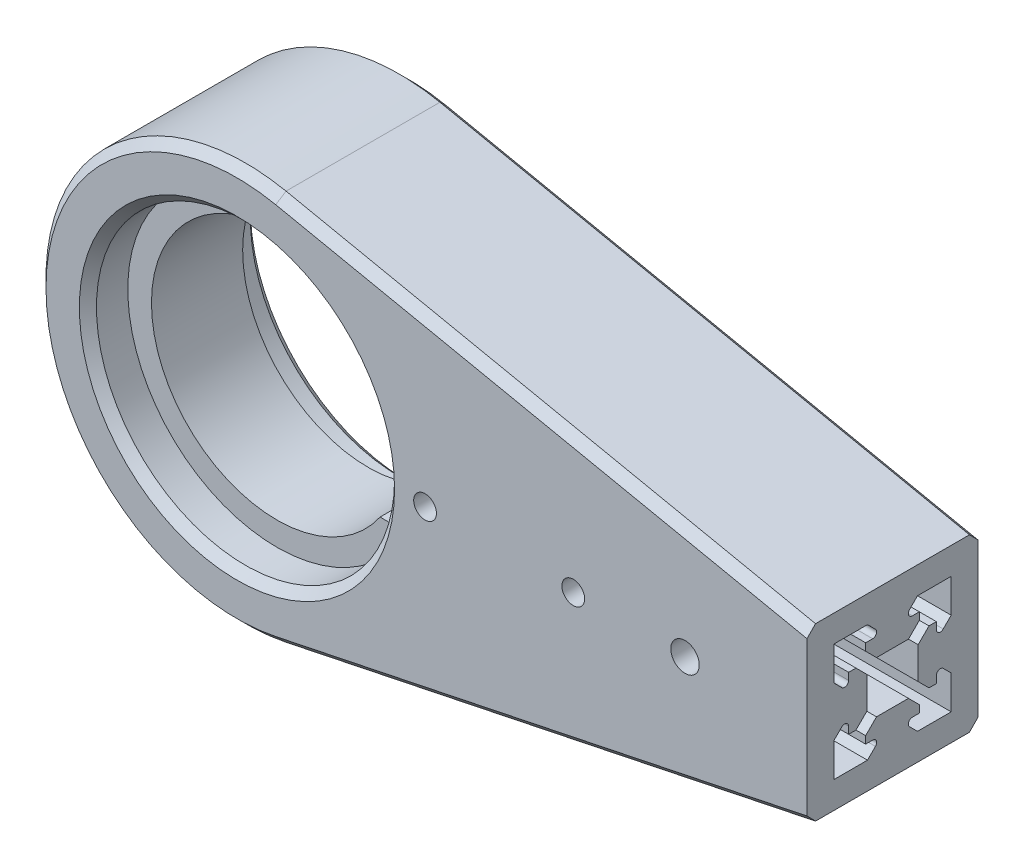
from build123d import *

# Parameters (mm, degrees)
SKETCH1_R           = 26.15
SKETCH1_R_2         = 2
SKETCH1_R_3         = 2.5
BOSS_EXTRUDE1_DEPTH = 30
BOSS_EXTRUDE2_START = -23
BOSS_EXTRUDE2_DEPTH = 16
CHAMFER1_SIZE       = 1.5
CUT_EXTRUDE1_DEPTH  = 90


with BuildPart() as part:
    # Sketch1 → Boss-Extrude1 (new body)
    with BuildSketch(Plane.XY):
        with BuildLine():
            Line((100, 15), (100, -15))
            Line((100, -15), (7.109450059, -34.270332941))
            ThreePointArc((7.109450059, -34.270332941), (-35, 0), (7.109450059, 34.270332941))
            Line((7.109450059, 34.270332941), (100, 15))
        make_face()
        Circle(SKETCH1_R, mode=Mode.SUBTRACT)
        with Locations((59, 0)):
            Circle(SKETCH1_R_2, mode=Mode.SUBTRACT)
        with Locations((78.6, 0)):
            Circle(SKETCH1_R_3, mode=Mode.SUBTRACT)
        with Locations((33, 0)):
            Circle(SKETCH1_R_2, mode=Mode.SUBTRACT)
    extrude(amount=BOSS_EXTRUDE1_DEPTH)

    # Sketch2 → Boss-Extrude2 (add)
    with BuildSketch(Plane.XY.offset(30).offset(BOSS_EXTRUDE2_START)):
        with BuildLine():
            Line((18.10386699, 12.5), (22.968946428, 12.5))
            ThreePointArc((22.968946428, 12.5), (-26.15, 0), (22.968946428, -12.5))
            Line((22.968946428, -12.5), (18.10386699, -12.5))
            ThreePointArc((18.10386699, -12.5), (-22, 0), (18.10386699, 12.5))
        make_face()
    extrude(amount=BOSS_EXTRUDE2_DEPTH)

    # Chamfer1
    chamfer1_edges = [part.edges().sort_by_distance(p)[0] for p in [
        (-26.15, 0, 30),
        (-26.15, 0, 0),
        (53.554725029, 24.63516647, 30),
        (-35, 0, 30),
        (53.554725029, -24.63516647, 30),
        (53.554725029, 24.63516647, 0),
        (-35, 0, 0),
        (53.554725029, -24.63516647, 0),
    ]]
    chamfer(chamfer1_edges, length=CHAMFER1_SIZE)

    # Sketch3 → Cut-Extrude1 (cut)
    with BuildSketch(Plane(origin=(100, 0, 0), x_dir=(0, 0, -1), z_dir=(1, 0, 0))):
        with BuildLine():
            Line((-12.197056275, 4.5), (-17.802943725, 4.5))
            Line((-17.802943725, 4.5), (-19.710050506, 6.407106781))
            Line((-19.710050506, 6.407106781), (-19.710050506, 7.7))
            Line((-19.710050506, 7.7), (-18.482842712, 7.7))
            ThreePointArc((-18.482842712, 7.7), (-17.83612704, 8.132121597), (-17.987867966, 8.894974747))
            Line((-17.987867966, 8.894974747), (-19.387867966, 10.294974747))
            Line((-19.387867966, 10.294974747), (-25.294974747, 10.294974747))
            Line((-25.294974747, 10.294974747), (-25.294974747, 4.387867966))
            Line((-25.294974747, 4.387867966), (-23.894974747, 2.987867966))
            ThreePointArc((-23.894974747, 2.987867966), (-23.132121597, 2.83612704), (-22.7, 3.482842712))
            Line((-22.7, 3.482842712), (-22.7, 4.710050506))
            Line((-22.7, 4.710050506), (-21.407106781, 4.710050506))
            Line((-21.407106781, 4.710050506), (-19.5, 2.802943725))
            Line((-19.5, 2.802943725), (-19.5, -2.802943725))
            Line((-19.5, -2.802943725), (-21.407106781, -4.710050506))
            Line((-21.407106781, -4.710050506), (-22.7, -4.710050506))
            Line((-22.7, -4.710050506), (-22.7, -3.482842712))
            ThreePointArc((-22.7, -3.482842712), (-23.132121597, -2.83612704), (-23.894974747, -2.987867966))
            Line((-23.894974747, -2.987867966), (-25.294974747, -4.387867966))
            Line((-25.294974747, -4.387867966), (-25.294974747, -10.294974747))
            Line((-25.294974747, -10.294974747), (-19.387867966, -10.294974747))
            Line((-19.387867966, -10.294974747), (-17.987867966, -8.894974747))
            ThreePointArc((-17.987867966, -8.894974747), (-17.83612704, -8.132121597), (-18.482842712, -7.7))
            Line((-18.482842712, -7.7), (-19.710050506, -7.7))
            Line((-19.710050506, -7.7), (-19.710050506, -6.407106781))
            Line((-19.710050506, -6.407106781), (-17.802943725, -4.5))
            Line((-17.802943725, -4.5), (-12.197056275, -4.5))
            Line((-12.197056275, -4.5), (-10.289949494, -6.407106781))
            Line((-10.289949494, -6.407106781), (-10.289949494, -7.7))
            Line((-10.289949494, -7.7), (-11.517157288, -7.7))
            ThreePointArc((-11.517157288, -7.7), (-12.16387296, -8.132121597), (-12.012132034, -8.894974747))
            Line((-12.012132034, -8.894974747), (-10.612132034, -10.294974747))
            Line((-10.612132034, -10.294974747), (-4.705025253, -10.294974747))
            Line((-4.705025253, -10.294974747), (-4.705025253, -4.387867966))
            Line((-4.705025253, -4.387867966), (-6.105025253, -2.987867966))
            ThreePointArc((-6.105025253, -2.987867966), (-6.867878403, -2.83612704), (-7.3, -3.482842712))
            Line((-7.3, -3.482842712), (-7.3, -4.710050506))
            Line((-7.3, -4.710050506), (-8.592893219, -4.710050506))
            Line((-8.592893219, -4.710050506), (-10.5, -2.802943725))
            Line((-10.5, -2.802943725), (-10.5, 2.802943725))
            Line((-10.5, 2.802943725), (-8.592893219, 4.710050506))
            Line((-8.592893219, 4.710050506), (-7.3, 4.710050506))
            Line((-7.3, 4.710050506), (-7.3, 3.482842712))
            ThreePointArc((-7.3, 3.482842712), (-6.867878403, 2.83612704), (-6.105025253, 2.987867966))
            Line((-6.105025253, 2.987867966), (-4.705025253, 4.387867966))
            Line((-4.705025253, 4.387867966), (-4.705025253, 10.294974747))
            Line((-4.705025253, 10.294974747), (-10.612132034, 10.294974747))
            Line((-10.612132034, 10.294974747), (-12.012132034, 8.894974747))
            ThreePointArc((-12.012132034, 8.894974747), (-12.16387296, 8.132121597), (-11.517157288, 7.7))
            Line((-11.517157288, 7.7), (-10.289949494, 7.7))
            Line((-10.289949494, 7.7), (-10.289949494, 6.407106781))
            Line((-10.289949494, 6.407106781), (-12.197056275, 4.5))
        make_face()
    extrude(amount=-CUT_EXTRUDE1_DEPTH, mode=Mode.SUBTRACT)


solid = part.part
